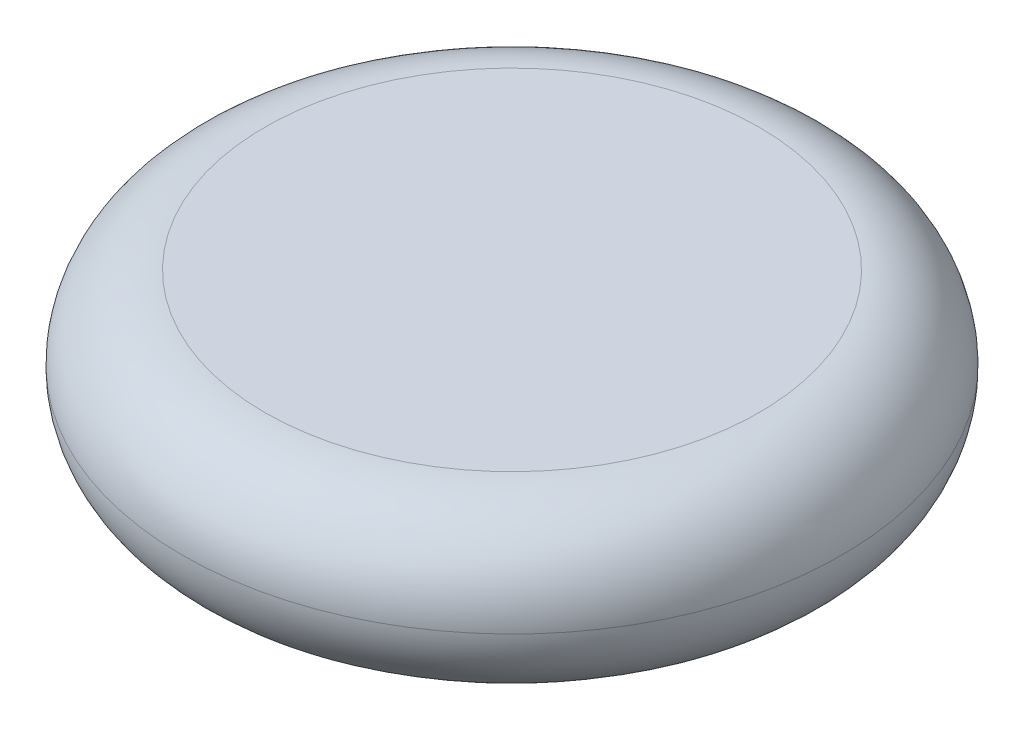
from build123d import *

# Parameters (mm, degrees)
BOSS_EXTRUDE1_DEPTH      = 50.8
BOSS_EXTRUDE1_DEPTH_BACK = 50.8
SKETCH1_R                = 203.2
FILLET1_R                = 50.8


with BuildPart() as part:
    # Sketch1 → Boss-Extrude1 (new, two sides: drawn at the far end of the back side and taken through both)
    with BuildSketch(Plane(origin=(0, 0, 0), x_dir=(1, 0, 0), z_dir=(0, 1, 0)).offset(-BOSS_EXTRUDE1_DEPTH_BACK)):
        with Locations(Location((0, 0, 0), (0, 0, 270))):
            Circle(SKETCH1_R)
    extrude(amount=BOSS_EXTRUDE1_DEPTH + BOSS_EXTRUDE1_DEPTH_BACK)

    # Fillet1
    fillet1_edges = [part.edges().sort_by_distance(p)[0] for p in [
        (0, 50.8, -203.2),
        (0, -50.8, -203.2),
    ]]
    fillet(fillet1_edges, radius=FILLET1_R - 0.0001)  # a hair under: the kernel refuses the full size


solid = part.part
